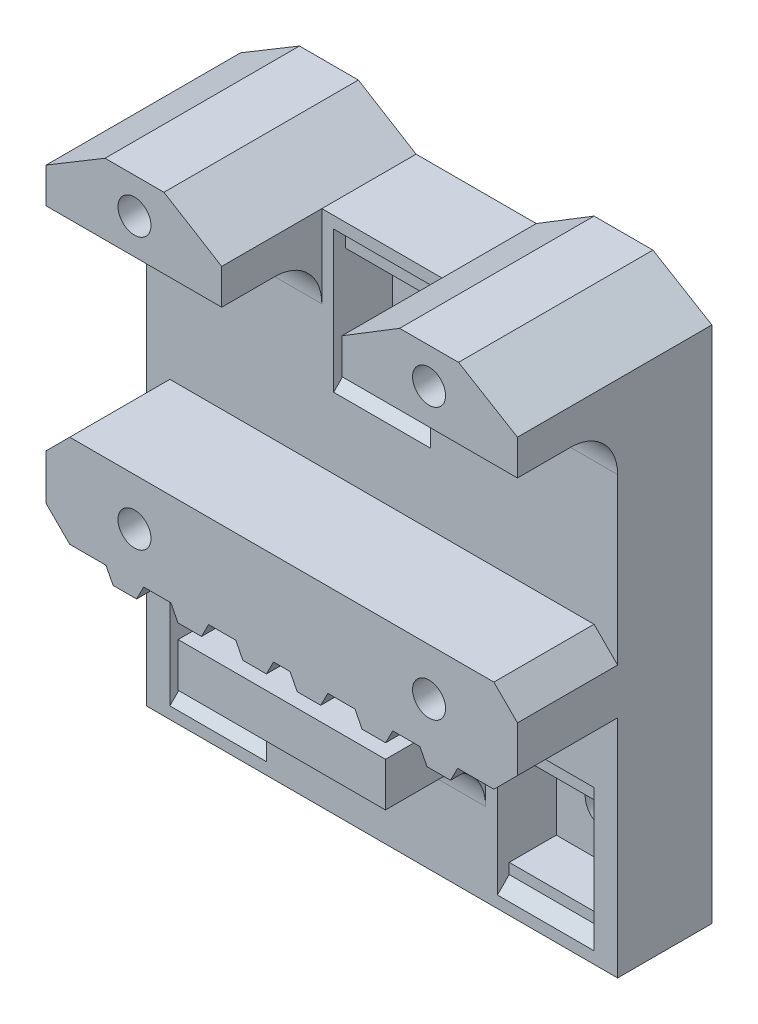
from build123d import *

# Parameters (mm, degrees)
SKETCH1_W                       = 40
SKETCH1_H                       = 44
BOSS_EXTRUDE1_DEPTH             = 8
SKETCH2_W                       = 8.2
SKETCH2_H                       = 10
CUT_EXTRUDE1_DEPTH              = 1
SKETCH3_W                       = 8.2
SKETCH3_H                       = 8.2
CUT_EXTRUDE2_DEPTH              = 4
CHAMFER1_SIZE                   = 1
SKETCH4_R                       = 1.65
CUT_EXTRUDE3_DEPTH              = 56.398555938
SKETCH5_W                       = 17.6
SKETCH5_H                       = 3.725
BOSS_EXTRUDE2_DEPTH             = 8.5
BOSS_EXTRUDE2_DIRECTION_2_REACH = 57.749
FILLET1_R                       = 4
SKETCH6_R                       = 1.4
CUT_EXTRUDE4_DEPTH              = 10
CHAMFER2_SIZE                   = 2


with BuildPart() as part:
    # Sketch1 → Boss-Extrude1 (new body)
    with BuildSketch(Plane.XY):
        with Locations((20, 16)):
            Rectangle(SKETCH1_W, SKETCH1_H)
    extrude(amount=BOSS_EXTRUDE1_DEPTH)

    # Sketch2 → Cut-Extrude1 (cut)
    with BuildSketch(Plane.XY.offset(8)):
        with Locations((20, 31)):
            Rectangle(SKETCH2_W, SKETCH2_H)
        with Locations((6.1, 1)):
            Rectangle(SKETCH2_W, SKETCH2_H)
        with Locations((33.9, 1)):
            Rectangle(SKETCH2_W, SKETCH2_H)
    extrude(amount=-CUT_EXTRUDE1_DEPTH, mode=Mode.SUBTRACT)

    # Sketch3 → Cut-Extrude2 (cut)
    with BuildSketch(Plane.XY.offset(7)):
        with Locations((20, 31)):
            Rectangle(SKETCH3_W, SKETCH3_H)
        with Locations((6.1, 1)):
            Rectangle(SKETCH3_W, SKETCH3_H)
        with Locations((33.9, 1)):
            Rectangle(SKETCH3_W, SKETCH3_H)
    extrude(amount=-CUT_EXTRUDE2_DEPTH, mode=Mode.SUBTRACT)

    # Chamfer1
    chamfer1_edges = [part.edges().sort_by_distance(p)[0] for p in [
        (20, 26, 8),
        (20, 36, 8),
        (33.9, -4, 8),
        (33.9, 6, 8),
        (6.1, -4, 8),
        (6.1, 6, 8),
    ]]
    chamfer(chamfer1_edges, length=CHAMFER1_SIZE - 0.0001)  # a hair under: the kernel refuses the full size

    # Sketch4 → Cut-Extrude3 (cut, through all)
    with BuildSketch(Plane.XY.offset(3)):
        with Locations((20, 31)):
            Circle(SKETCH4_R)
        with Locations((6.1, 1)):
            Circle(SKETCH4_R)
        with Locations((33.9, 1)):
            Circle(SKETCH4_R)
    extrude(amount=-CUT_EXTRUDE3_DEPTH, mode=Mode.SUBTRACT)

    # Sketch5 → Boss-Extrude2 (add)
    with BuildSketch(Plane.XY.offset(8)):
        Polygon((20.704347826, 11.125), (19.295652174, 11.125), (18.695652174, 9.944955324), (16.695652174, 9.944955324), (16.095652174, 11.125), (15.195652174, 11.125), (13.786956522, 11.125), (13.186956522, 9.944955324), (11.186956522, 9.944955324), (10.586956522, 11.125), (9.686956522, 11.125), (8.27826087, 11.125), (7.67826087, 9.944955324), (5.67826087, 9.944955324), (5.07826087, 11.125), (4.17826087, 11.125), (0, 11.125), (0, 19), (40, 19), (40, 11.125), (35.82173913, 11.125), (34.92173913, 11.125), (34.32173913, 9.944955324), (32.32173913, 9.944955324), (31.72173913, 11.125), (30.313043478, 11.125), (29.413043478, 11.125), (28.813043478, 9.944955324), (26.813043478, 9.944955324), (26.213043478, 11.125), (24.804347826, 11.125), (23.904347826, 11.125), (23.304347826, 9.944955324), (21.304347826, 9.944955324), align=None)
        with Locations((20, 6.8625)):
            Rectangle(SKETCH5_W, SKETCH5_H)
        Polygon((0, 35), (14.9, 35), (14.9, 38), (10, 41), (5, 41), (0, 38), align=None)
        Polygon((25.1, 38), (30, 41), (35, 41), (40, 38), (40, 35), (25.1, 35), align=None)
    extrude(amount=BOSS_EXTRUDE2_DEPTH)

    # Boss-Extrude2 direction 2: up to this face of the body (flat: up to its plane)
    boss_extrude2_direction_2_end = Plane(part.part.faces().sort_by_distance((20, 16.073973219, 0))[0])
    # Sketch5 → Boss-Extrude2 direction 2 (add, up to the picked face)
    with BuildSketch(Plane.XY.offset(8), mode=Mode.PRIVATE) as boss_extrude2_direction_2_sk1:
        Polygon((20.704347826, 11.125), (19.295652174, 11.125), (18.695652174, 9.944955324), (16.695652174, 9.944955324), (16.095652174, 11.125), (15.195652174, 11.125), (13.786956522, 11.125), (13.186956522, 9.944955324), (11.186956522, 9.944955324), (10.586956522, 11.125), (9.686956522, 11.125), (8.27826087, 11.125), (7.67826087, 9.944955324), (5.67826087, 9.944955324), (5.07826087, 11.125), (4.17826087, 11.125), (0, 11.125), (0, 19), (40, 19), (40, 11.125), (35.82173913, 11.125), (34.92173913, 11.125), (34.32173913, 9.944955324), (32.32173913, 9.944955324), (31.72173913, 11.125), (30.313043478, 11.125), (29.413043478, 11.125), (28.813043478, 9.944955324), (26.813043478, 9.944955324), (26.213043478, 11.125), (24.804347826, 11.125), (23.904347826, 11.125), (23.304347826, 9.944955324), (21.304347826, 9.944955324), align=None)
    boss_extrude2_direction_2_tool1 = split(extrude(boss_extrude2_direction_2_sk1.sketch, amount=-BOSS_EXTRUDE2_DIRECTION_2_REACH, mode=Mode.PRIVATE), bisect_by=boss_extrude2_direction_2_end, keep=Keep.BOTH, mode=Mode.PRIVATE)
    # Sketch5 → Boss-Extrude2 direction 2 (add, up to the picked face)
    with BuildSketch(Plane.XY.offset(8), mode=Mode.PRIVATE) as boss_extrude2_direction_2_sk2:
        with Locations((20, 6.8625)):
            Rectangle(SKETCH5_W, SKETCH5_H)
    boss_extrude2_direction_2_tool2 = split(extrude(boss_extrude2_direction_2_sk2.sketch, amount=-BOSS_EXTRUDE2_DIRECTION_2_REACH, mode=Mode.PRIVATE), bisect_by=boss_extrude2_direction_2_end, keep=Keep.BOTH, mode=Mode.PRIVATE)
    # Sketch5 → Boss-Extrude2 direction 2 (add, up to the picked face)
    with BuildSketch(Plane.XY.offset(8), mode=Mode.PRIVATE) as boss_extrude2_direction_2_sk3:
        Polygon((0, 35), (14.9, 35), (14.9, 38), (10, 41), (5, 41), (0, 38), align=None)
    boss_extrude2_direction_2_tool3 = split(extrude(boss_extrude2_direction_2_sk3.sketch, amount=-BOSS_EXTRUDE2_DIRECTION_2_REACH, mode=Mode.PRIVATE), bisect_by=boss_extrude2_direction_2_end, keep=Keep.BOTH, mode=Mode.PRIVATE)
    # Sketch5 → Boss-Extrude2 direction 2 (add, up to the picked face)
    with BuildSketch(Plane.XY.offset(8), mode=Mode.PRIVATE) as boss_extrude2_direction_2_sk4:
        Polygon((25.1, 38), (30, 41), (35, 41), (40, 38), (40, 35), (25.1, 35), align=None)
    boss_extrude2_direction_2_tool4 = split(extrude(boss_extrude2_direction_2_sk4.sketch, amount=-BOSS_EXTRUDE2_DIRECTION_2_REACH, mode=Mode.PRIVATE), bisect_by=boss_extrude2_direction_2_end, keep=Keep.BOTH, mode=Mode.PRIVATE)
    add(boss_extrude2_direction_2_tool1.solids().sort_by(Axis((20, 14.815025, 8), (0, 0, -1)))[0])
    add(boss_extrude2_direction_2_tool2.solids().sort_by(Axis((20, 6.8625, 8), (0, 0, -1)))[0])
    add(boss_extrude2_direction_2_tool3.solids().sort_by(Axis((7.45835, 37.60161, 8), (0, 0, -1)))[0])
    add(boss_extrude2_direction_2_tool4.solids().sort_by(Axis((32.54165, 37.60161, 8), (0, 0, -1)))[0])

    # Fillet1
    fillet1_edges = [part.edges().sort_by_distance(p)[0] for p in [
        (20, 5, 8),
        (7.45, 35, 8),
        (32.55, 35, 8),
    ]]
    fillet(fillet1_edges, radius=FILLET1_R)

    # Sketch6 → Cut-Extrude4 (cut)
    with BuildSketch(Plane.XY.offset(16.5)):
        with Locations((7.5, 38)):
            Circle(SKETCH6_R)
        with Locations((7.5, 15)):
            Circle(SKETCH6_R)
        with Locations(Location((32.5, 38, 0), (0, 0, 180))):
            Circle(SKETCH6_R)
        with Locations(Location((32.5, 15, 0), (0, 0, 180))):
            Circle(SKETCH6_R)
    extrude(amount=-CUT_EXTRUDE4_DEPTH, mode=Mode.SUBTRACT)

    # Chamfer2
    chamfer2_edges = [part.edges().sort_by_distance(p)[0] for p in [
        (0, 11.125, 12.25),
        (0, 19, 12.25),
        (40, 19, 12.25),
        (40, 11.125, 12.25),
    ]]
    chamfer(chamfer2_edges, length=CHAMFER2_SIZE)


solid = part.part
